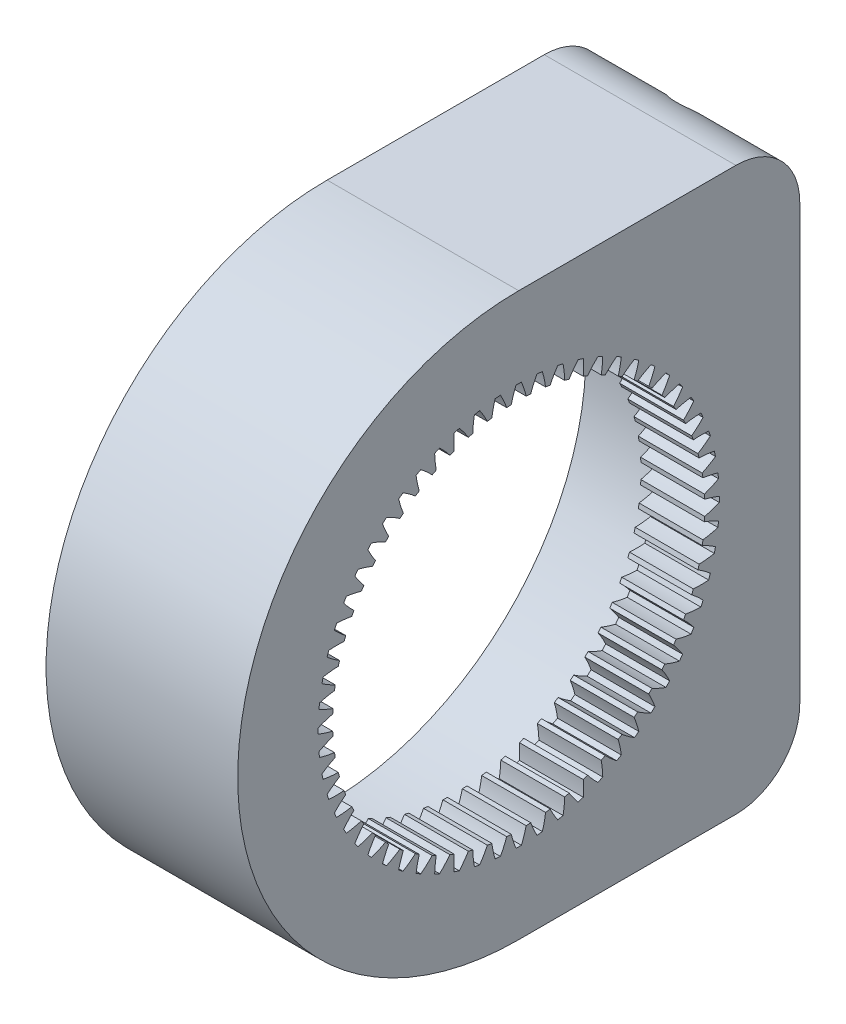
from build123d import *

# Parameters (mm, degrees)
BASPROSKE_W         = 10
BASPROSKE_H         = 14.855
TOOTHCUT_DEPTH      = 64.023805026
TEETHCUTS_COUNT     = 60
TEETHCUTS_ANGLE     = 354
SKETCH4_R           = 44
SKETCH4_R_2         = 40.5
BOSS_EXTRUDE3_DEPTH = 20
BOSS_EXTRUDE5_DEPTH = 30
SKETCH8_R           = 4.25
CUT_EXTRUDE1_DEPTH  = 20
BOSS_EXTRUDE6_DEPTH = 30
SKETCH11_R          = 4.25
CUT_EXTRUDE2_DEPTH  = 20
FILLET1_R           = 10


with BuildPart() as part:
    # BasProSke → Base-Revolve (revolve)
    with BuildSketch(Plane(origin=(0, 0, 0), x_dir=(1, 0, 0), z_dir=(0, 1, 0)), mode=Mode.PRIVATE) as base_revolve_sk:
        with Locations((5, 36.5725)):
            Rectangle(BASPROSKE_W, BASPROSKE_H)
    revolve(base_revolve_sk.sketch.rotate(Axis((-10, 0, 0), (1, 0, 0)), 180), axis=Axis((-10, 0, 0), (1, 0, 0)))

    # TooCutSke → ToothCut (cut, through all)
    with BuildSketch(Plane(origin=(0, 0, 0), x_dir=(0, 0, -1), z_dir=(1, 0, 0))):
        with BuildLine():
            ThreePointArc((1.172230257, 29.095995951), (0.843099295, 30.265361829), (0.420881468, 31.404429805))
            ThreePointArc((0.420881468, 31.404429805), (0, 31.40725), (-0.420881468, 31.404429805))
            ThreePointArc((-0.420881468, 31.404429805), (-0.843099295, 30.265361829), (-1.172230257, 29.095995951))
            ThreePointArc((-1.172230257, 29.095995951), (0, 29.1196), (1.172230257, 29.095995951))
        make_face()
    toothcut = extrude(amount=TOOTHCUT_DEPTH, mode=Mode.SUBTRACT)

    # TeethCuts: ToothCut ×60 about axis
    teethcuts_axis = Axis((-10, 0, 0), (1, 0, 0))
    for i in range(1, TEETHCUTS_COUNT):
        add(toothcut.rotate(teethcuts_axis, i * TEETHCUTS_ANGLE / (TEETHCUTS_COUNT - 1)), mode=Mode.SUBTRACT)

    # Sketch4 → Boss-Extrude3 (add)
    with BuildSketch(Plane.ZY):
        Circle(SKETCH4_R)
        Circle(SKETCH4_R_2, mode=Mode.SUBTRACT)
    extrude(amount=BOSS_EXTRUDE3_DEPTH)

    # Sketch7 → Boss-Extrude5 (add)
    with BuildSketch(Plane(origin=(10, 0, 0), x_dir=(0, 0, -1), z_dir=(1, 0, 0))):
        with BuildLine():
            Line((0, 44), (44, 44))
            Line((44, 44), (44, 0))
            ThreePointArc((44, 0), (31.112698372, 31.112698372), (0, 44))
        make_face()
    extrude(amount=-BOSS_EXTRUDE5_DEPTH)

    # Sketch8 → Cut-Extrude1 (cut)
    with BuildSketch(Plane(origin=(0, 0, -44), x_dir=(-1, 0, 0), z_dir=(0, 0, -1))):
        with Locations(Location((5, 38, 0), (0, 0, 90))):
            Circle(SKETCH8_R)
    extrude(amount=-CUT_EXTRUDE1_DEPTH, mode=Mode.SUBTRACT)

    # Sketch10 → Boss-Extrude6 (add)
    with BuildSketch(Plane(origin=(10, 0, 0), x_dir=(0, 0, -1), z_dir=(1, 0, 0))):
        with BuildLine():
            Line((0, -44), (44, -44))
            Line((44, -44), (44, 0))
            ThreePointArc((44, 0), (31.112698372, -31.112698372), (0, -44))
        make_face()
    extrude(amount=-BOSS_EXTRUDE6_DEPTH)

    # Sketch11 → Cut-Extrude2 (cut)
    with BuildSketch(Plane(origin=(0, 0, -44), x_dir=(-1, 0, 0), z_dir=(0, 0, -1))):
        with Locations(Location((5, -38, 0), (0, 0, 90))):
            Circle(SKETCH11_R)
    extrude(amount=-CUT_EXTRUDE2_DEPTH, mode=Mode.SUBTRACT)

    # Fillet1
    # the kernel refuses this fillet: 10 mm, written as the material it takes off along each edge
    with BuildSketch(Plane(origin=(35, 44, -44), x_dir=(0, 0, 1), z_dir=(-1, 0, 0)), Plane(origin=(35, -44, -44), x_dir=(0, 1, 0), z_dir=(-1, 0, 0))) as fillet1_piece_1:
        with BuildLine():
            CenterArc((FILLET1_R, -FILLET1_R), FILLET1_R, 90, 90)
            Line((0, -FILLET1_R), (0, 0))
            Line((0, 0), (FILLET1_R, 0))
        make_face()
    extrude(amount=80, mode=Mode.SUBTRACT)


solid = part.part
